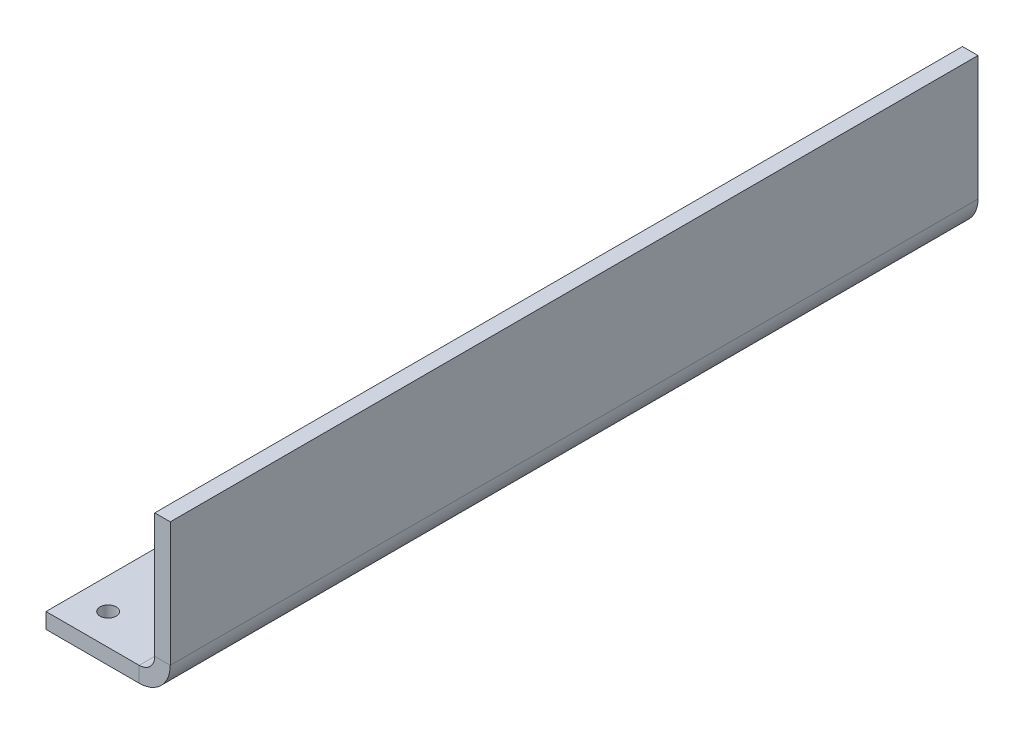
from build123d import *

# Parameters (mm, degrees)
SKETCH2_W                   = 165.1
SKETCH2_H                   = 25.4
BASE_FLANGE1_DEPTH          = 3.175
EDGE_FLANGE1_DEPTH          = 165.1
F_1_8_0_13_DIAMETER_HOLE1_D = 3.302


# Sheet-metal steps are written as plain solids
with BuildPart() as part:
    # Sketch2 → Base-Flange1 (new body)
    with BuildSketch(Plane(origin=(0, 0, 0), x_dir=(0, 0, -1), z_dir=(1, 0, 0))):
        Rectangle(SKETCH2_W, SKETCH2_H)
    extrude(amount=-BASE_FLANGE1_DEPTH)

    # Edge-Flange1 section (across the edge) → Edge-Flange1 (add)
    with BuildSketch(Plane(origin=(-3.175, -15.875, -82.55), x_dir=(0, 1, 0), z_dir=(0, 0, 1))):
        with BuildLine():
            Line((-3.175, 3.175), (-3.175, 22.225))
            Line((-3.175, 22.225), (0, 22.225))
            Line((0, 22.225), (0, 3.175))
            ThreePointArc((0, 3.175), (0.92993597, 0.92993597), (3.175, 0))
            Line((3.175, 0), (3.175, -3.175))
            ThreePointArc((3.175, -3.175), (-1.315128061, -1.315128061), (-3.175, 3.175))
        make_face()
    extrude(amount=EDGE_FLANGE1_DEPTH)

    # 1/8 (0.13) Diameter Hole1 (through all)
    with Locations(Plane(origin=(0, -15.875, 0), x_dir=(1, 0, 0), z_dir=(0, 1, 0))):
        with Locations((-12.7, 76.2), (-19.05, 50.8), (-12.7, 12.7), (-19.05, -12.7), (-12.7, -50.8), (-19.05, -76.2)):
            Hole(F_1_8_0_13_DIAMETER_HOLE1_D / 2)


solid = part.part
